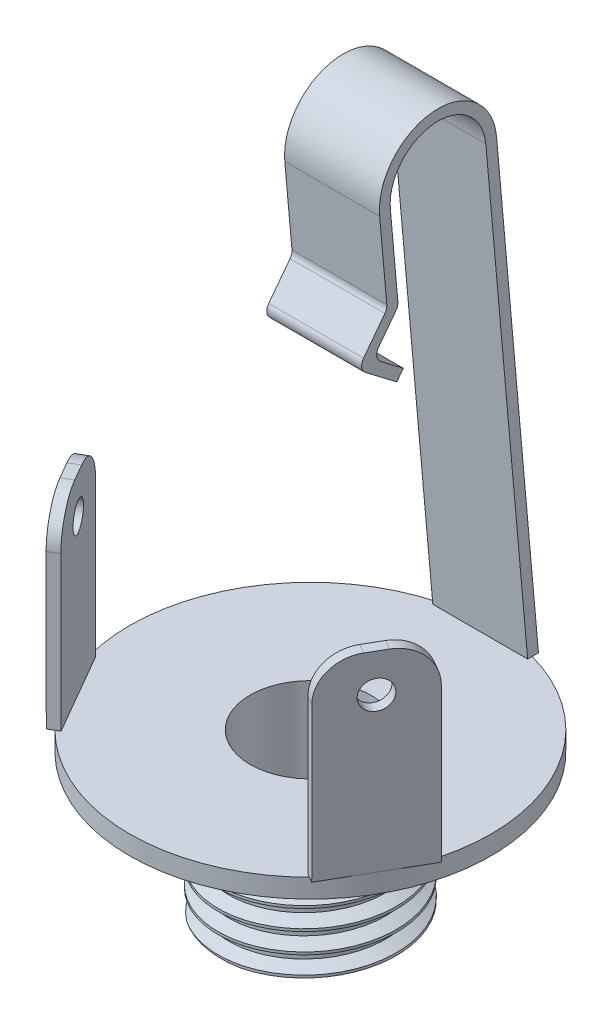
from build123d import *

# Parameters (mm, degrees)
SKETCH1_R                = 4.699
SKETCH1_R_2              = 3.175
BOSS_EXTRUDE2_DEPTH      = 7.112
BOSS_EXTRUDE3_START      = 1
SKETCH1_5_R              = 9.525
SKETCH1_5_R_2            = 4.699
SKETCH1_5_R_3            = 3.175
BOSS_EXTRUDE3_DEPTH      = 1
BOSS_EXTRUDE4_DEPTH      = 2.5
BOSS_EXTRUDE4_DEPTH_BACK = 2.5
BOSS_EXTRUDE5_DEPTH      = 2.5
FILLET1_R                = 2
CUT_EXTRUDE1_REACH       = 38.501
SKETCH4_R                = 0.75
FILLET1_OF_MIRROR1_R     = 2
THREAD1_PITCH            = 1.058333333


with BuildPart() as part:
    # Sketch1 → Boss-Extrude2 (new body)
    with BuildSketch(Plane(origin=(0, 0, 0), x_dir=(1, 0, 0), z_dir=(0, 1, 0))):
        with Locations(Location((0, 0, 0), (0, 0, 270))):
            Circle(SKETCH1_R)
        with Locations(Location((0, 0, 0), (0, 0, 270))):
            Circle(SKETCH1_R_2, mode=Mode.SUBTRACT)
    extrude(amount=-BOSS_EXTRUDE2_DEPTH)

    # Sketch1<5> → Boss-Extrude3 (add)
    # profile 1 of 2: a face of its own
    with BuildSketch(Plane(origin=(0, 0, 0), x_dir=(1, 0, 0), z_dir=(0, 1, 0)).offset(BOSS_EXTRUDE3_START)):
        with Locations(Location((0, 0, 0), (0, 0, 270))):
            Circle(SKETCH1_5_R)
        with Locations(Location((0, 0, 0), (0, 0, 270))):
            Circle(SKETCH1_5_R_2, mode=Mode.SUBTRACT)
    # profile 2 of 2: a face of its own
    with BuildSketch(Plane(origin=(0, 0, 0), x_dir=(1, 0, 0), z_dir=(0, 1, 0)).offset(BOSS_EXTRUDE3_START)):
        with Locations(Location((0, 0, 0), (0, 0, 270))):
            Circle(SKETCH1_5_R_2)
        with Locations(Location((0, 0, 0), (0, 0, 270))):
            Circle(SKETCH1_5_R_3, mode=Mode.SUBTRACT)
    extrude(amount=-BOSS_EXTRUDE3_DEPTH)

    # Sketch2 → Boss-Extrude4 (add, two sides: drawn at the far end of the back side and taken through both)
    with BuildSketch(Plane(origin=(0, 0, 0), x_dir=(0, 0, -1), z_dir=(1, 0, 0)).offset(-BOSS_EXTRUDE4_DEPTH_BACK)):
        with BuildLine():
            Line((9.525, 1), (8.955348726, 1))
            Line((8.955348726, 1), (6.749586457, 25.625462161))
            ThreePointArc((6.749586457, 25.625462161), (4.007030779, 27.917093518), (1.715399422, 25.174537839))
            Line((1.715399422, 25.174537839), (2.113779905, 20.726958125))
            ThreePointArc((2.113779905, 20.726958125), (2.096243091, 20.543969928), (2.013761769, 20.379686479))
            Line((2.013761769, 20.379686479), (1.097735578, 19.175157881))
            ThreePointArc((1.097735578, 19.175157881), (1.000287792, 18.805089592), (1.193059599, 18.474505805))
            Line((1.193059599, 18.474505805), (2.397588197, 17.558479614))
            Line((2.397588197, 17.558479614), (2.054137338, 17.106858923))
            Line((2.054137338, 17.106858923), (0.397988048, 18.366335973))
            ThreePointArc((0.397988048, 18.366335973), (0.205216242, 18.696919759), (0.302664027, 19.066988048))
            Line((0.302664027, 19.066988048), (1.429025549, 20.54809708))
            ThreePointArc((1.429025549, 20.54809708), (1.511506871, 20.71238053), (1.529043686, 20.895368727))
            Line((1.529043686, 20.895368727), (1.150282207, 25.123918922))
            ThreePointArc((1.150282207, 25.123918922), (3.956411862, 28.482210733), (7.314703672, 25.676081078))
            Line((7.314703672, 25.676081078), (9.525, 1))
        make_face()
    extrude(amount=BOSS_EXTRUDE4_DEPTH + BOSS_EXTRUDE4_DEPTH_BACK)

    # Sketch3 → Boss-Extrude5 (add, symmetric)
    with BuildSketch(Plane(origin=(0, 0, 0), x_dir=(0, 1, 0), z_dir=(0.500000000000001, 0, 0.866025403784438))):
        Polygon((1, 9.525), (11.106549808, 9.531853637), (11.106549808, 8.961853506), (1, 8.954999869), align=None)
    boss_extrude5 = extrude(amount=BOSS_EXTRUDE5_DEPTH, both=True)

    # Fillet1
    fillet1_edges = [part.edges().sort_by_distance(p)[0] for p in [
        (-9.258010098, 11.106549808, 2.458363276),
        (-6.758010098, 11.106549808, 6.788490295),
    ]]
    fillet(fillet1_edges, radius=FILLET1_R)

    # Sketch4 → Cut-Extrude1 (cut, up to next)
    with BuildSketch(Plane(origin=(-8.248300893, -0.006458803, 4.762158741), x_dir=(0.49999973174186424, 0.00039152302944135816, 0.8660254701611155), z_dir=(-0.8660252046543747, -0.0006781379872297707, 0.4999998850322056)), mode=Mode.PRIVATE) as cut_extrude1_sk1:
        with Locations(Location((0.004351001, 9.113988816, 0), (0, 0, 359.977567377))):
            Circle(SKETCH4_R)
    cut_extrude1_tool1 = extrude(cut_extrude1_sk1.sketch, amount=-CUT_EXTRUDE1_REACH, mode=Mode.PRIVATE) & part.part
    cut_extrude1 = cut_extrude1_tool1.solids().sort_by_distance((-8.253262, 9.107529, 4.765927))[0]
    add(cut_extrude1, mode=Mode.SUBTRACT)

    # Mirror1: Boss-Extrude5, Cut-Extrude1 across plane
    add(boss_extrude5.mirror(Plane(origin=(0, 0, 0), x_dir=(0, 0, 1), z_dir=(1, 0, 0))))
    add(cut_extrude1.mirror(Plane(origin=(0, 0, 0), x_dir=(0, 0, 1), z_dir=(1, 0, 0))), mode=Mode.SUBTRACT)

    # Fillet1 of Mirror1
    fillet1_of_mirror1_edges = [part.edges().sort_by_distance(p)[0] for p in [
        (9.258010098, 11.106549808, 2.458363276),
        (6.758010098, 11.106549808, 6.788490295),
    ]]
    fillet(fillet1_of_mirror1_edges, radius=FILLET1_OF_MIRROR1_R)

    # Thread1: the profile of Thread Profile1 profile screwed along a right-hand helix of 6.72 turns, 8 arcs to a turn; built about Z, then put on its axis
    thread1_z = Axis((0, 0, 0), (0, 0, 1))
    thread1_corners = [(4.6993, 0, -0.000173205), (4.6993, 0, 0.926214869), (4.126160282, 0, 0.595312499), (4.126160282, 0, 0.330729165)]
    with BuildLine(mode=Mode.PRIVATE) as thread1_profile:
        Line(thread1_corners[0], thread1_corners[1])
        Line(thread1_corners[1], thread1_corners[2])
        Line(thread1_corners[2], thread1_corners[3])
        Line(thread1_corners[3], thread1_corners[0])
    thread1_cap = Face(thread1_profile.wire())
    thread1_turn_angles = [0, 22.5, 45, 67.5, 90, 112.5, 135, 157.5, 180, 202.5, 225, 247.5, 270, 292.5, 315, 337.5, 360]
    thread1_turn_weights = [1, 0.9238795325112867, 1, 0.9238795325112867, 1, 0.9238795325112867, 1, 0.9238795325112867, 1, 0.9238795325112867, 1, 0.9238795325112867, 1, 0.9238795325112867, 1, 0.9238795325112867, 1]
    thread1_turn_rails = [Edge.make_bspline([Vector(p[0], p[1], 0).rotate(thread1_z, thread1_turn_angles[k]) / thread1_turn_weights[k] + Vector(0, 0, p[2] + THREAD1_PITCH * thread1_turn_angles[k] / 360) for k in range(17)], [0, 0, 0, 1, 1, 2, 2, 3, 3, 4, 4, 5, 5, 6, 6, 7, 7, 8, 8, 8], 2, thread1_turn_weights) for p in thread1_corners]
    thread1_turn_sides = [Face.make_surface_from_curves(thread1_turn_rails[p[0]], thread1_turn_rails[p[1]]) for p in [(0, 1), (1, 2), (2, 3), (3, 0)]]
    thread1_last_angles = [2160, 2182.5, 2205, 2227.5, 2250, 2272.5, 2295, 2317.5, 2340, 2362.5, 2385, 2402.1, 2419.2]
    thread1_last_weights = [1, 0.9238795325112867, 1, 0.9238795325112867, 1, 0.9238795325112867, 1, 0.9238795325112867, 1, 0.9238795325112867, 1, 0.9557930147983295, 1]
    thread1_last_rails = [Edge.make_bspline([Vector(p[0], p[1], 0).rotate(thread1_z, thread1_last_angles[k]) / thread1_last_weights[k] + Vector(0, 0, p[2] + THREAD1_PITCH * thread1_last_angles[k] / 360) for k in range(13)], [0, 0, 0, 1, 1, 2, 2, 3, 3, 4, 4, 5, 5, 6, 6, 6], 2, thread1_last_weights) for p in thread1_corners]
    thread1_last_sides = [Face.make_surface_from_curves(thread1_last_rails[p[0]], thread1_last_rails[p[1]]) for p in [(0, 1), (1, 2), (2, 3), (3, 0)]]
    thread1 = Plane(origin=(0, 0, 0), x_dir=(-1, 0, 0), z_dir=(0, -1, 0)) * Solid(Shell([*[p.moved(Location((0, 0, THREAD1_PITCH * i))) for i in range(6) for p in thread1_turn_sides], *thread1_last_sides, thread1_cap, thread1_cap.rotate(thread1_z, 2419.2).moved(Location((0, 0, THREAD1_PITCH * 2419.2 / 360)))]))
    add(thread1, mode=Mode.SUBTRACT)


solid = part.part
